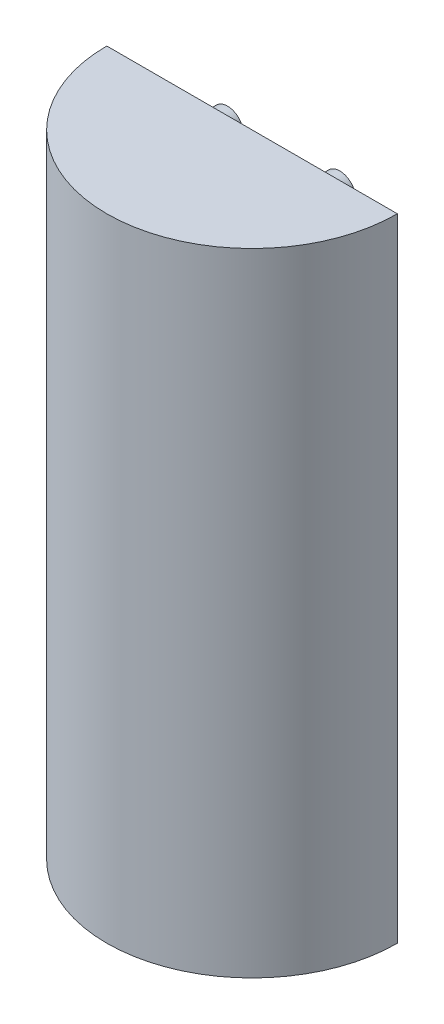
from build123d import *

# Parameters (mm, degrees)
EXTRUDE_1_DEPTH = 100
SKETCH_2_R      = 2.5
EXTRUDE_2_DEPTH = 5


with BuildPart() as part:
    # Эскиз1 → Бобышка-Вытянуть1 (new body)
    with BuildSketch(Plane(origin=(0, 0, 0), x_dir=(1, 0, 0), z_dir=(0, 1, 0))):
        with BuildLine():
            Line((-23, 0), (23, 0))
            ThreePointArc((23, 0), (0, -23), (-23, 0))
        make_face()
    extrude(amount=EXTRUDE_1_DEPTH)

    # Эскиз2 → Бобышка-Вытянуть2 (add)
    with BuildSketch(Plane(origin=(0, 0, 0), x_dir=(-1, 0, 0), z_dir=(0, 0, -1))):
        with Locations((-8.89, 93.815)):
            Circle(SKETCH_2_R)
        with Locations((8.89, 93.815)):
            Circle(SKETCH_2_R)
        with Locations((-8.89, 6.185)):
            Circle(SKETCH_2_R)
        with Locations((8.89, 6.185)):
            Circle(SKETCH_2_R)
    extrude(amount=EXTRUDE_2_DEPTH)


solid = part.part
